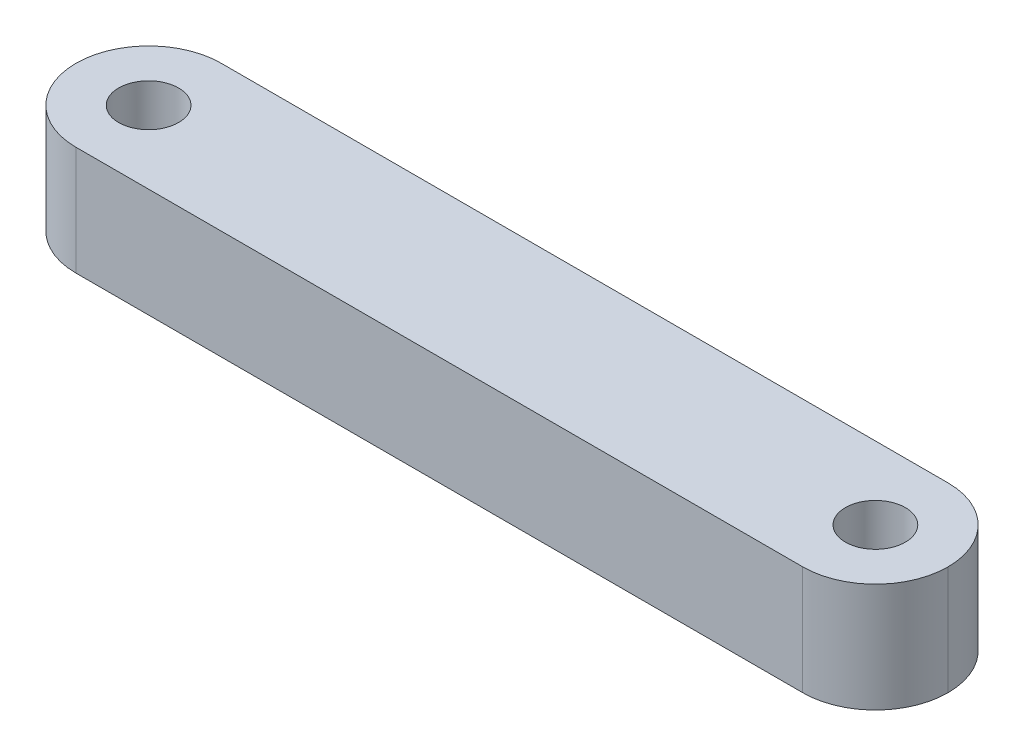
from build123d import *

# Parameters (mm, degrees)
SKETCH_1_W          = 48
SKETCH_1_H          = 8
EXTRUDE_1_DEPTH     = 6
SKETCH_2_R          = 1.65
CUT_EXTRUDE_1_DEPTH = 15
FILLET_1_R          = 4


with BuildPart() as part:
    # 草图1 → 凸台-拉伸1 (new body)
    with BuildSketch(Plane(origin=(0, 0, 0), x_dir=(1, 0, 0), z_dir=(0, 1, 0))):
        Rectangle(SKETCH_1_W, SKETCH_1_H)
    extrude(amount=EXTRUDE_1_DEPTH)

    # 草图2 → 切除-拉伸1 (cut)
    with BuildSketch(Plane(origin=(0, 6, 0), x_dir=(1, 0, 0), z_dir=(0, 1, 0))):
        with Locations(Location((20, 0, 0), (0, 0, 270))):
            Circle(SKETCH_2_R)
        with Locations(Location((-20, 0, 0), (0, 0, 270))):
            Circle(SKETCH_2_R)
    extrude(amount=-CUT_EXTRUDE_1_DEPTH, mode=Mode.SUBTRACT)

    # 圆角1
    fillet_1_edges = [part.edges().sort_by_distance(p)[0] for p in [
        (-24, 3, 4),
        (-24, 3, -4),
        (24, 3, -4),
        (24, 3, 4),
    ]]
    fillet(fillet_1_edges, radius=FILLET_1_R - 0.0001)  # a hair under: the kernel refuses the full size


solid = part.part
